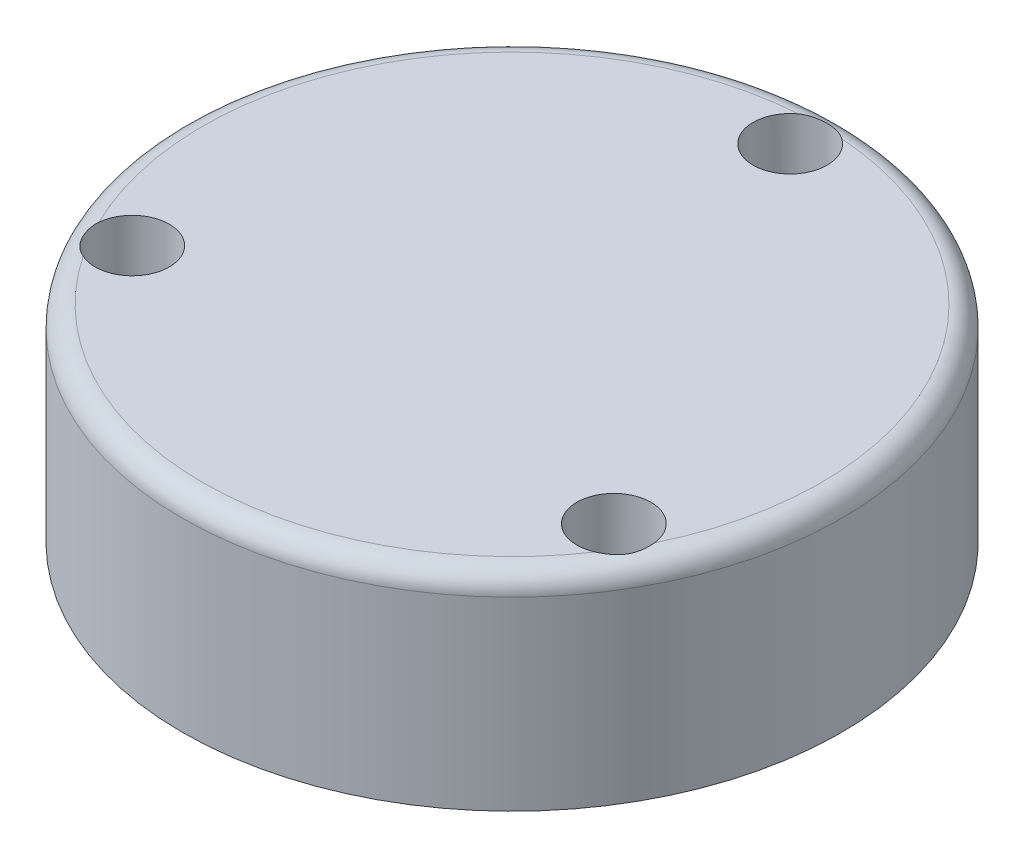
from build123d import *

# Parameters (mm, degrees)
SKETCH_1_R          = 16
EXTRUDE_1_DEPTH     = 10
SKETCH_2_R          = 1.8
CUT_EXTRUDE_1_DEPTH = 20
FILLET_1_R          = 1
FILLET_2_R          = 0.5


with BuildPart() as part:
    # Эскиз1 → Бобышка-Вытянуть1 (new body)
    with BuildSketch(Plane(origin=(0, 0, 0), x_dir=(1, 0, 0), z_dir=(0, 1, 0))):
        with Locations(Location((0, 0, 0), (0, 0, 270))):
            Circle(SKETCH_1_R)
    extrude(amount=EXTRUDE_1_DEPTH)

    # Эскиз2 → Вырез-Вытянуть1 (cut)
    with BuildSketch(Plane(origin=(0, 10, 0), x_dir=(1, 0, 0), z_dir=(0, 1, 0))):
        with Locations(Location((0, 13.5, 0), (0, 0, 270))):
            Circle(SKETCH_2_R)
        with Locations(Location((11.691342951, -6.75, 0), (0, 0, 270))):
            Circle(SKETCH_2_R)
        with Locations(Location((-11.691342951, -6.75, 0), (0, 0, 270))):
            Circle(SKETCH_2_R)
    extrude(amount=-CUT_EXTRUDE_1_DEPTH, mode=Mode.SUBTRACT)

    # Скругление1
    # the kernel refuses this fillet: 1 mm, written as the material it takes off along each edge
    with BuildSketch(Plane(origin=(0, 10, 0), x_dir=(0, 0, 1), z_dir=(-1, 0, 0))) as fillet_1_piece_1:
        with BuildLine():
            CenterArc((16 - FILLET_1_R, -FILLET_1_R), FILLET_1_R, 0, 90)
            Line((16 - FILLET_1_R, 0), (16, 0))
            Line((16, 0), (16, -FILLET_1_R))
        make_face()
    revolve(axis=Axis((0, 10, 0), (0, 1, 0)), mode=Mode.SUBTRACT)

    # Скругление2
    fillet_2_edges = [part.edges().sort_by_distance(p)[0] for p in [
        (11.691342951, 0, 4.95),
        (-11.691342951, 0, 4.95),
        (0, 0, -15.3),
    ]]
    fillet(fillet_2_edges, radius=FILLET_2_R)


solid = part.part
